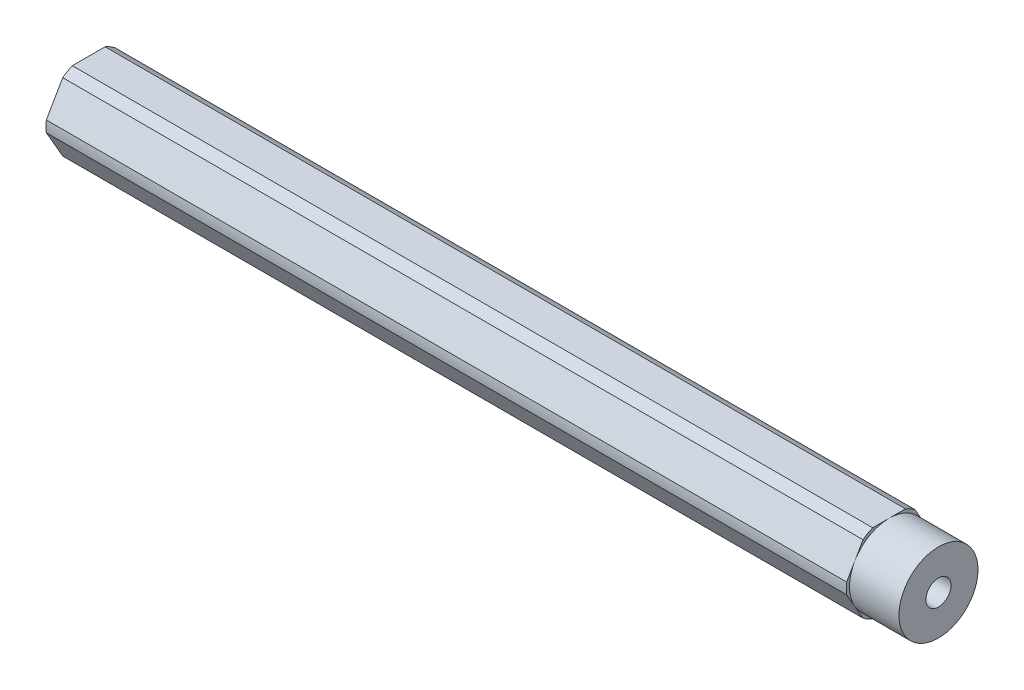
from build123d import *

# Parameters (mm, degrees)
SKETCH1_R                            = 2.0193
BOSS_EXTRUDE1_DEPTH                  = 68.2625
F_10_32_TAPPED_HOLE1_D               = 4.0386
F_10_32_TAPPED_HOLE1_DEPTH           = 16.34744
F_10_32_TAPPED_HOLE1_TIP             = 1.213317848
F_10_32_TAPPED_HOLE1_ON_FACE_2_D     = 4.0386
F_10_32_TAPPED_HOLE1_ON_FACE_2_DEPTH = 16.34744
F_10_32_TAPPED_HOLE1_ON_FACE_2_TIP   = 1.213317848
SKETCH3_R                            = 8.89
SKETCH3_R_2                          = 6.35
CUT_EXTRUDE_THIN1_DEPTH              = 7.9375


with BuildPart() as part:
    # Sketch1 → Boss-Extrude1 (new, symmetric)
    with BuildSketch(Plane(origin=(0, 0, 0), x_dir=(0, 0, -1), z_dir=(1, 0, 0))):
        with BuildLine():
            ThreePointArc((4.181770846, 5.456960429), (3.437499983, 5.953924622), (2.634980936, 6.35))
            Line((2.634980936, 6.35), (-2.634980936, 6.35))
            ThreePointArc((-2.634980936, 6.35), (-3.437499983, 5.953924622), (-4.181770846, 5.456960429))
            Line((-4.181770846, 5.456960429), (-6.816751782, 0.893039571))
            ThreePointArc((-6.816751782, 0.893039571), (-6.874999966, 0), (-6.816751782, -0.893039571))
            Line((-6.816751782, -0.893039571), (-4.181770846, -5.456960429))
            ThreePointArc((-4.181770846, -5.456960429), (-3.437499983, -5.953924622), (-2.634980936, -6.35))
            Line((-2.634980936, -6.35), (2.634980936, -6.35))
            ThreePointArc((2.634980936, -6.35), (3.437499983, -5.953924622), (4.181770846, -5.456960429))
            Line((4.181770846, -5.456960429), (6.816751782, -0.893039571))
            ThreePointArc((6.816751782, -0.893039571), (6.860422465, -0.447468582), (6.874999966, 0))
            ThreePointArc((6.874999966, 0), (6.860422465, 0.447468582), (6.816751782, 0.893039571))
            Line((6.816751782, 0.893039571), (4.181770846, 5.456960429))
        make_face()
        Circle(SKETCH1_R, mode=Mode.SUBTRACT)
    extrude(amount=BOSS_EXTRUDE1_DEPTH, both=True)

    # #10-32 Tapped Hole1
    with Locations(Plane(origin=(68.2625, 0, 0), x_dir=(0, 0, 1), z_dir=(1, 0, 0))):
        with Locations((0, 0)):
            Hole(F_10_32_TAPPED_HOLE1_D / 2, depth=F_10_32_TAPPED_HOLE1_DEPTH)
            with Locations((0, 0, -(F_10_32_TAPPED_HOLE1_DEPTH + F_10_32_TAPPED_HOLE1_TIP / 2))):  # 118° drill point
                Cone(0, F_10_32_TAPPED_HOLE1_D / 2, F_10_32_TAPPED_HOLE1_TIP, mode=Mode.SUBTRACT)

    # #10-32 Tapped Hole1 on face 2
    with Locations(Plane(origin=(-68.2625, 0, 0), x_dir=(0, 0, 1), z_dir=(1, 0, 0))):
        with Locations((0, 0)):
            Hole(F_10_32_TAPPED_HOLE1_ON_FACE_2_D / 2, depth=F_10_32_TAPPED_HOLE1_ON_FACE_2_DEPTH)
            with Locations((0, 0, -(F_10_32_TAPPED_HOLE1_ON_FACE_2_DEPTH + F_10_32_TAPPED_HOLE1_ON_FACE_2_TIP / 2))):  # 118° drill point
                Cone(0, F_10_32_TAPPED_HOLE1_ON_FACE_2_D / 2, F_10_32_TAPPED_HOLE1_ON_FACE_2_TIP, mode=Mode.SUBTRACT)

    # Sketch3 → Cut-Extrude-Thin1 (cut)
    with BuildSketch(Plane(origin=(68.2625, 0, 0), x_dir=(0, 0, -1), z_dir=(1, 0, 0))):
        Circle(SKETCH3_R)
        Circle(SKETCH3_R_2, mode=Mode.SUBTRACT)
    extrude(amount=-CUT_EXTRUDE_THIN1_DEPTH, mode=Mode.SUBTRACT)


solid = part.part
